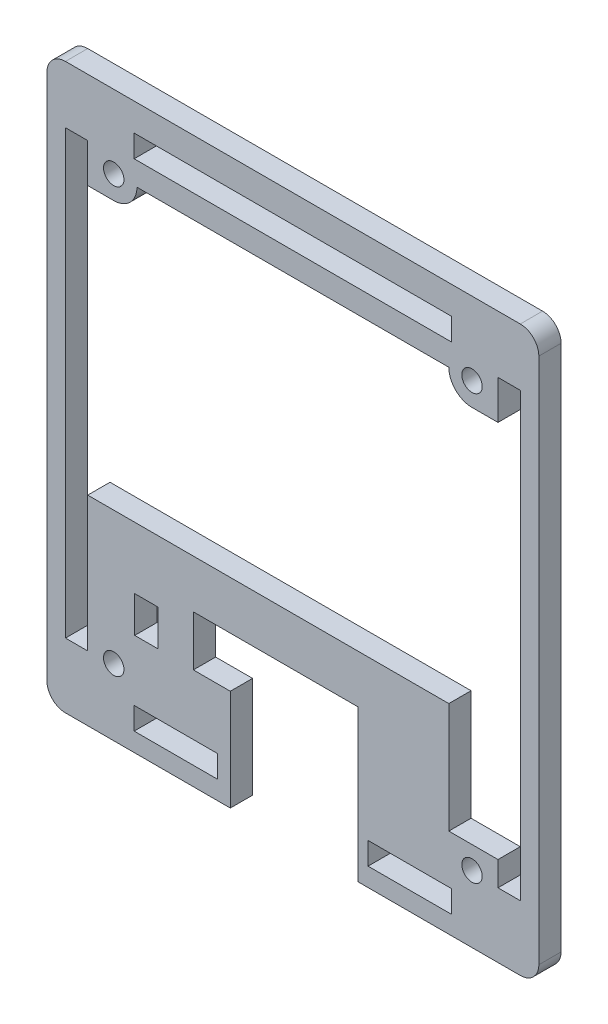
from build123d import *

# Parameters (mm, degrees)
SKETCH1_R           = 1.397
SKETCH1_W           = 3.175
SKETCH1_H           = 4.953
SKETCH1_W_2         = 11.43
SKETCH1_H_2         = 3.048
SKETCH1_W_3         = 43.434
BOSS_EXTRUDE1_DEPTH = 3.048
FILLET1_R           = 2.54


with BuildPart() as part:
    # Sketch1 → Boss-Extrude1 (new body)
    with BuildSketch(Plane.XY):
        Polygon((-3.7846, 71.611586257), (-3.7846, -5.588), (21.3106, -5.588), (21.3106, -4.3434), (21.3106, 8.255), (16.256, 8.255), (16.256, 15.1384), (38.7858, 15.1384), (38.7858, -4.3434), (38.7858, -5.588), (63.5254, -5.588), (63.5254, 71.611586257), align=None)
        with Locations((5.3594, 3.556)):
            Circle(SKETCH1_R, mode=Mode.SUBTRACT)
        with Locations((9.8171, 10.8077)):
            Rectangle(SKETCH1_W, SKETCH1_H, mode=Mode.SUBTRACT)
        with Locations((13.8684, -1.524)):
            Rectangle(SKETCH1_W_2, SKETCH1_H_2, mode=Mode.SUBTRACT)
        with Locations((45.8724, -1.524)):
            Rectangle(SKETCH1_W_2, SKETCH1_H_2, mode=Mode.SUBTRACT)
        with Locations((54.3814, 3.556)):
            Circle(SKETCH1_R, mode=Mode.SUBTRACT)
        with BuildLine():
            Line((-1.2446, 63.754), (1.8034, 63.754))
            Line((1.8034, 63.754), (1.8034, 58.42))
            Line((1.8034, 58.42), (5.3594, 58.42))
            ThreePointArc((5.3594, 58.42), (7.60446403, 59.34993597), (8.5344, 61.595))
            Line((8.5344, 61.595), (51.2064, 61.595))
            ThreePointArc((51.2064, 61.595), (52.13633597, 59.34993597), (54.3814, 58.42))
            Line((54.3814, 58.42), (57.9374, 58.42))
            Line((57.9374, 58.42), (57.9374, 63.754))
            Line((57.9374, 63.754), (60.9854, 63.754))
            Line((60.9854, 63.754), (60.9854, 3.2766))
            Line((60.9854, 3.2766), (57.9374, 3.2766))
            Line((57.9374, 3.2766), (57.9374, 6.6294))
            Line((57.9374, 6.6294), (51.2064, 6.6294))
            Line((51.2064, 6.6294), (51.2064, 21.7424))
            Line((51.2064, 21.7424), (1.8034, 21.7424))
            Line((1.8034, 21.7424), (1.8034, 3.2766))
            Line((1.8034, 3.2766), (-1.2446, 3.2766))
            Line((-1.2446, 3.2766), (-1.2446, 63.754))
        make_face(mode=Mode.SUBTRACT)
        with Locations((5.3594, 61.595)):
            Circle(SKETCH1_R, mode=Mode.SUBTRACT)
        with Locations((29.8704, 66.294)):
            Rectangle(SKETCH1_W_3, SKETCH1_H_2, mode=Mode.SUBTRACT)
        with Locations((54.3814, 61.595)):
            Circle(SKETCH1_R, mode=Mode.SUBTRACT)
    extrude(amount=BOSS_EXTRUDE1_DEPTH)

    # Fillet1
    fillet1_edges = [part.edges().sort_by_distance(p)[0] for p in [
        (-3.7846, -5.588, 1.524),
        (63.5254, -5.588, 1.524),
        (63.5254, 71.611586257, 1.524),
        (-3.7846, 71.611586257, 1.524),
    ]]
    fillet(fillet1_edges, radius=FILLET1_R)


solid = part.part
